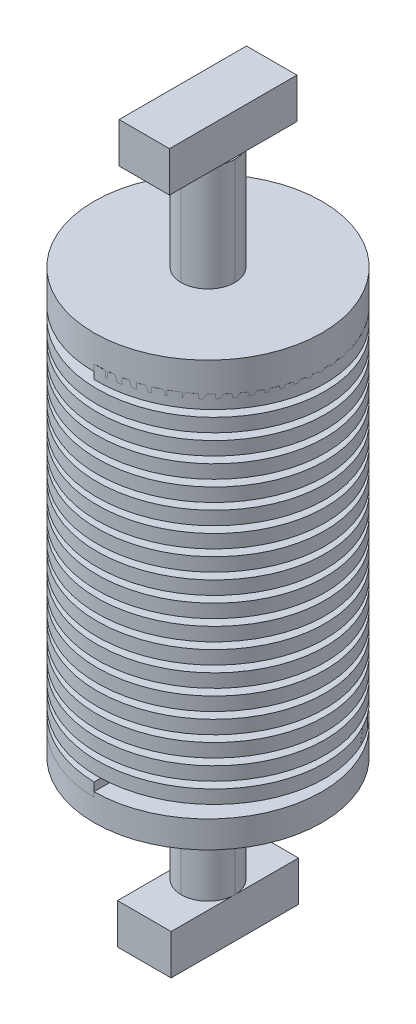
from build123d import *

# Parameters (mm, degrees)
SWEEP1_PITCH              = 1.5
SWEEP1_HEIGHT             = 27
SWEEP1_RADIUS             = 7.5
SKETCH4_W                 = 4
SKETCH4_H                 = 1
SKETCH5_R                 = 8.5
BOSS_EXTRUDE1_DEPTH       = 2
SKETCH15_W                = 4
SKETCH15_H                = 4
BOSS_EXTRUDE16_DEPTH      = 8
SKETCH19_W                = 9.5
SKETCH19_H                = 3
BOSS_EXTRUDE17_DEPTH      = 4
FILLET1_R                 = 2
BOSS_EXTRUDE19_DEPTH      = 2
BOSS_EXTRUDE19_DEPTH_BACK = 0.5
SKETCH20_R                = 8.5
SKETCH21_W                = 4
SKETCH21_H                = 4
BOSS_EXTRUDE20_DEPTH      = 8
SKETCH22_W                = 9.5
SKETCH22_H                = 3
BOSS_EXTRUDE21_DEPTH      = 4
FILLET2_R                 = 2
SKETCH24_W                = 0.12
SKETCH24_H                = 9.5
CUT_EXTRUDE3_DEPTH        = 3


with BuildPart() as part:
    # Sweep1: sweep along a helix
    with BuildLine() as sweep1_path:
        Helix(SWEEP1_PITCH, SWEEP1_HEIGHT, SWEEP1_RADIUS, center=(0, 0, 0), direction=(0, 1, 0), lefthand=True)
    # Sketch4 → Sweep1 (sweep)
    with BuildSketch(Plane.XY):
        with Locations((-6.5, 0.500000002)):
            Rectangle(SKETCH4_W, SKETCH4_H)
    sweep(path=sweep1_path.line, is_frenet=True)

    # Sketch5 → Boss-Extrude1 (add)
    with BuildSketch(Plane(origin=(0, 0, 0), x_dir=(1, 0, 0), z_dir=(0, 1, 0))):
        with Locations(Location((0, 0, 0), (0, 0, 270))):
            Circle(SKETCH5_R)
    extrude(amount=-BOSS_EXTRUDE1_DEPTH)

    # Sketch15 → Boss-Extrude16 (add)
    with BuildSketch(Plane.XZ.offset(2)):
        Rectangle(SKETCH15_W, SKETCH15_H)
    extrude(amount=BOSS_EXTRUDE16_DEPTH)

    # Sketch19 → Boss-Extrude17 (add)
    with BuildSketch(Plane.ZY.offset(2)):
        with Locations((0, -11.405505012)):
            Rectangle(SKETCH19_W, SKETCH19_H)
    extrude(amount=-BOSS_EXTRUDE17_DEPTH)

    # Fillet1
    fillet1_edges = [part.edges().sort_by_distance(p)[0] for p in [
        (2, -5.952752506, -2),
        (2, -5.952752506, 2),
        (-2, -5.952752506, 2),
        (-2, -5.952752506, -2),
    ]]
    fillet(fillet1_edges, radius=FILLET1_R - 0.0001)  # a hair under: the kernel refuses the full size


with BuildPart() as body_2:
    # Sketch20 → Boss-Extrude19 (new, two sides: drawn at the far end of the back side and taken through both)
    with BuildSketch(Plane(origin=(0, 27.624999994, 0), x_dir=(1, 0, 0), z_dir=(0, 1, 0)).offset(-BOSS_EXTRUDE19_DEPTH_BACK)):
        with Locations(Location((0, 0, 0), (0, 0, 180))):
            Circle(SKETCH20_R)
    extrude(amount=BOSS_EXTRUDE19_DEPTH + BOSS_EXTRUDE19_DEPTH_BACK)

    # Sketch21 → Boss-Extrude20 (add)
    with BuildSketch(Plane(origin=(0, 29.624999994, 0), x_dir=(1, 0, 0), z_dir=(0, 1, 0))):
        Rectangle(SKETCH21_W, SKETCH21_H)
    extrude(amount=BOSS_EXTRUDE20_DEPTH)

    # Sketch22 → Boss-Extrude21 (add)
    with BuildSketch(Plane(origin=(2, 0, 0), x_dir=(0, 0, -1), z_dir=(1, 0, 0))):
        with Locations((0, 39.08934501)):
            Rectangle(SKETCH22_W, SKETCH22_H)
    extrude(amount=-BOSS_EXTRUDE21_DEPTH)

    # Fillet2
    fillet2_edges = [body_2.edges().sort_by_distance(p)[0] for p in [
        (-2, 33.607172502, 2),
        (2, 33.607172502, 2),
        (2, 33.607172502, -2),
        (-2, 33.607172502, -2),
    ]]
    fillet(fillet2_edges, radius=FILLET2_R - 0.0001)  # a hair under: the kernel refuses the full size

    # Sketch24 → Cut-Extrude3 (cut)
    with BuildSketch(Plane(origin=(0, 40.58934501, 0), x_dir=(1, 0, 0), z_dir=(0, 1, 0))):
        with Locations((-1.94, 0)):
            Rectangle(SKETCH24_W, SKETCH24_H)
        with Locations((1.94, 0)):
            Rectangle(SKETCH24_W, SKETCH24_H)
    extrude(amount=-CUT_EXTRUDE3_DEPTH, mode=Mode.SUBTRACT)


solid = Compound([part.part, body_2.part])
